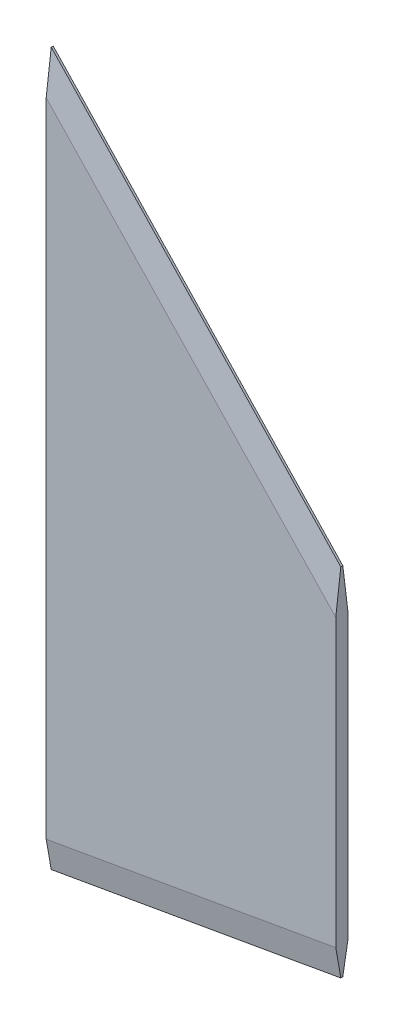
from build123d import *
from OCP.BRepFilletAPI import BRepFilletAPI_MakeChamfer

# Parameters (mm, degrees)
BOSS_EXTRUDE1_DEPTH = 1.5
CHAMFER1_SIZE       = 1.25
CHAMFER1_SIZE2      = 7.089102275


with BuildPart() as part:
    # Sketch1 → Boss-Extrude1 (new, symmetric)
    with BuildSketch(Plane.XY):
        Polygon((-60.98159975, 109.931238246), (-60.98159975, -67.868761754), (11.31315025, -55.168761754), (11.31315025, 33.731238246), align=None)
    extrude(amount=BOSS_EXTRUDE1_DEPTH, both=True)

    # Chamfer1: one chamfer whose edges measure the first distance from different faces: ONE call of the kernel's chamfer builder (chamfer() names one face for all edges)
    chamfer1_edges_1 = [part.edges().sort_by_distance(p)[0] for p in [
        (-24.83422475, -61.518761754, -1.5),
        (-24.83422475, -61.518761754, 1.5),
    ]]
    chamfer1_side_1 = [part.faces().sort_by_distance(p)[0] for p in [
        (-24.83422475, -61.518761754, 0),
    ]]
    chamfer1_edges_2 = [part.edges().sort_by_distance(p)[0] for p in [
        (-24.83422475, 71.831238246, -1.5),
        (-24.83422475, 71.831238246, 1.5),
    ]]
    chamfer1_side_2 = [part.faces().sort_by_distance(p)[0] for p in [
        (-24.83422475, 71.831238246, 0),
    ]]
    chamfer1 = BRepFilletAPI_MakeChamfer(part.part.solid().wrapped)
    for e in chamfer1_edges_1:
        chamfer1.Add(CHAMFER1_SIZE, CHAMFER1_SIZE2, e.wrapped, chamfer1_side_1[0].wrapped)  # the first distance lies on this face
    for e in chamfer1_edges_2:
        chamfer1.Add(CHAMFER1_SIZE, CHAMFER1_SIZE2, e.wrapped, chamfer1_side_2[0].wrapped)  # the first distance lies on this face
    add(Compound.cast(chamfer1.Shape()), mode=Mode.REPLACE)


solid = part.part
